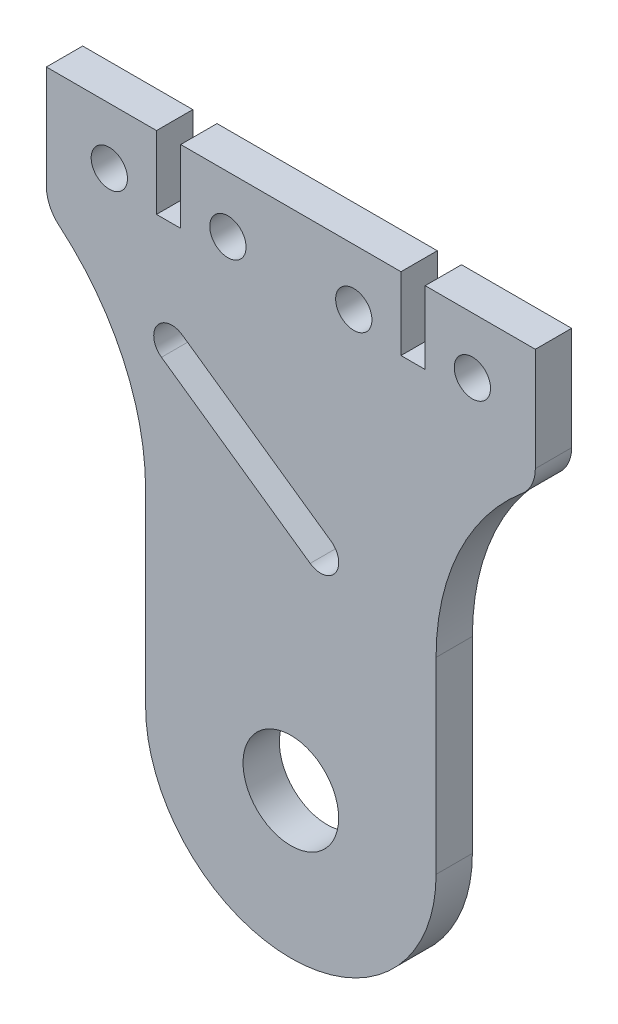
from build123d import *

# Parameters (mm, degrees)
SKETCH1_R           = 3.95
SKETCH1_R_2         = 1.5
BOSS_EXTRUDE1_DEPTH = 3
FILLET1_R           = 20
FILLET2_R           = 3
CUT_EXTRUDE1_DEPTH  = 3


with BuildPart() as part:
    # Sketch1 → Boss-Extrude1 (new body)
    with BuildSketch(Plane.XY):
        with BuildLine():
            Line((0, 41.674052381), (9.1, 41.674052381))
            Line((9.1, 41.674052381), (9.1, 35.674052381))
            Line((9.1, 35.674052381), (11.1, 35.674052381))
            Line((11.1, 35.674052381), (11.1, 41.674052381))
            Line((11.1, 41.674052381), (20.2, 41.674052381))
            Line((20.2, 41.674052381), (20.2, 31.674052381))
            Line((20.2, 31.674052381), (12, 31.674052381))
            Line((12, 31.674052381), (12, 0))
            ThreePointArc((12, 0), (0, -12), (-12, 0))
            Line((-12, 0), (-12, 31.674052381))
            Line((-12, 31.674052381), (-20.2, 31.674052381))
            Line((-20.2, 31.674052381), (-20.2, 41.674052381))
            Line((-20.2, 41.674052381), (-11.1, 41.674052381))
            Line((-11.1, 41.674052381), (-11.1, 35.674052381))
            Line((-11.1, 35.674052381), (-9.1, 35.674052381))
            Line((-9.1, 35.674052381), (-9.1, 41.674052381))
            Line((-9.1, 41.674052381), (0, 41.674052381))
        make_face()
        Circle(SKETCH1_R, mode=Mode.SUBTRACT)
        with Locations((-15, 37.024052381)):
            Circle(SKETCH1_R_2, mode=Mode.SUBTRACT)
        with Locations((-5.2, 37.024052381)):
            Circle(SKETCH1_R_2, mode=Mode.SUBTRACT)
        with Locations((5.2, 37.024052381)):
            Circle(SKETCH1_R_2, mode=Mode.SUBTRACT)
        with Locations((15, 37.024052381)):
            Circle(SKETCH1_R_2, mode=Mode.SUBTRACT)
    extrude(amount=BOSS_EXTRUDE1_DEPTH)

    # Fillet1
    # the kernel refuses this fillet: 20 mm, written as the material it adds along each edge
    with BuildSketch(Plane(origin=(-12, 31.674052381, 0), x_dir=(0, -1, 0), z_dir=(0, 0, 1))) as fillet1_piece_1:
        with BuildLine():
            CenterArc((16.1480649, -20), FILLET1_R, 90, 53.842991799)
            Line((0, -8.2), (-0.322961298, -7.964))
            ThreePointArc((-0.322961298, -7.964), (-0.4, -4.1), (-0.4, 0))
            Line((-0.4, 0), (0, 0.4))
            Line((0, 0.4), (16.1480649, 0.4))
            Line((16.1480649, 0.4), (16.1480649, 0))
        make_face()
    extrude(amount=3)
    with BuildSketch(Plane(origin=(12, 31.674052381, 0), x_dir=(0, -1, 0), z_dir=(0, 0, 1))) as fillet1_piece_2:
        with BuildLine():
            CenterArc((16.1480649, 20), FILLET1_R, 216.157008201, 53.842991799)
            Line((0, 8.2), (-0.322961298, 7.964))
            ThreePointArc((-0.322961298, 7.964), (-0.4, 4.1), (-0.4, 0))
            Line((-0.4, 0), (0, -0.4))
            Line((0, -0.4), (16.1480649, -0.4))
            Line((16.1480649, -0.4), (16.1480649, 0))
        make_face()
    extrude(amount=3)

    # Fillet2
    fillet2_edges = [part.edges().sort_by_distance(p)[0] for p in [
        (20.2, 31.674052381, 1.5),
        (-20.2, 31.674052381, 1.5),
    ]]
    fillet(fillet2_edges, radius=FILLET2_R)

    # Sketch2 → Cut-Extrude1 (cut)
    with BuildSketch(Plane.XY.offset(3)):
        with BuildLine():
            Line((-10.690189186, 25.65418917), (1.597091478, 17.050542625))
            ThreePointArc((1.597091478, 17.050542625), (3.686184199, 17.418906036), (3.317820787, 19.507998757))
            Line((3.317820787, 19.507998757), (-8.969459877, 28.111645303))
            ThreePointArc((-8.969459877, 28.111645303), (-11.058552598, 27.743281891), (-10.690189186, 25.65418917))
        make_face()
    extrude(amount=-CUT_EXTRUDE1_DEPTH, mode=Mode.SUBTRACT)


solid = part.part
